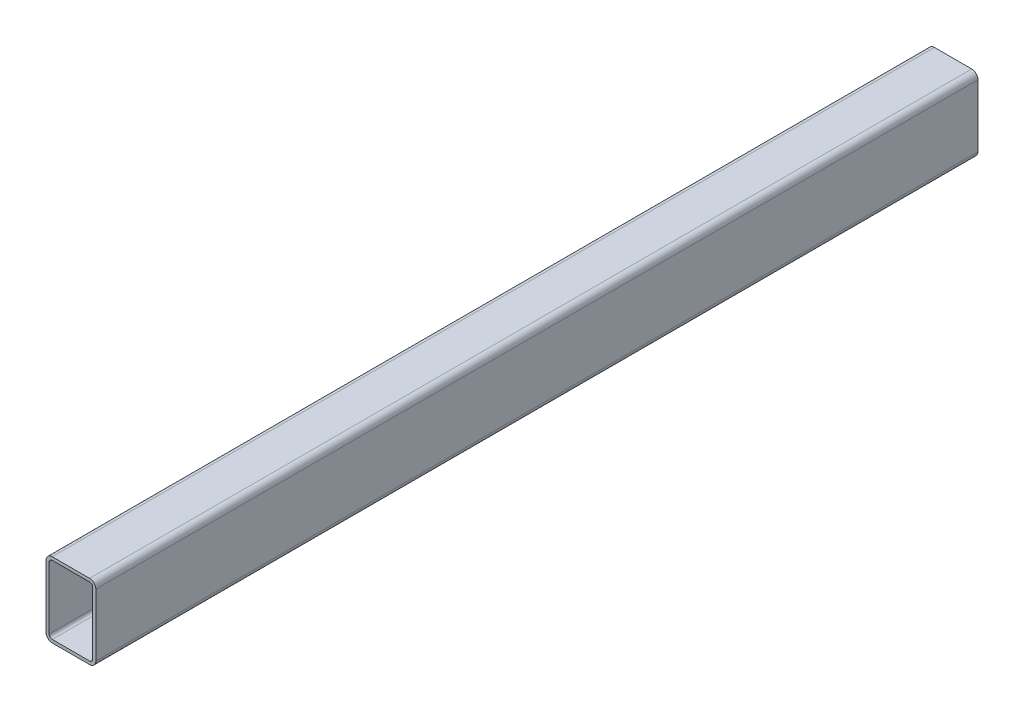
from build123d import *

# Parameters (mm, degrees)
BOSS_EXTRUDE2_DEPTH = 449.961


with BuildPart() as part:
    # Sketch13 → Boss-Extrude2 (new, symmetric)
    with BuildSketch(Plane.XY):
        with BuildLine():
            Line((19.05, -38.1), (-19.05, -38.1))
            ThreePointArc((-19.05, -38.1), (-23.540128061, -36.240128061), (-25.4, -31.75))
            Line((-25.4, -31.75), (-25.4, 31.75))
            ThreePointArc((-25.4, 31.75), (-23.540128061, 36.240128061), (-19.05, 38.1))
            Line((-19.05, 38.1), (19.05, 38.1))
            ThreePointArc((19.05, 38.1), (23.540128061, 36.240128061), (25.4, 31.75))
            Line((25.4, 31.75), (25.4, -31.75))
            ThreePointArc((25.4, -31.75), (23.540128061, -36.240128061), (19.05, -38.1))
        make_face()
        with BuildLine():
            Line((19.05, -34.925), (-19.05, -34.925))
            ThreePointArc((-19.05, -34.925), (-21.29506403, -33.99506403), (-22.225, -31.75))
            Line((-22.225, -31.75), (-22.225, 31.75))
            ThreePointArc((-22.225, 31.75), (-21.29506403, 33.99506403), (-19.05, 34.925))
            Line((-19.05, 34.925), (19.05, 34.925))
            ThreePointArc((19.05, 34.925), (21.29506403, 33.99506403), (22.225, 31.75))
            Line((22.225, 31.75), (22.225, -31.75))
            ThreePointArc((22.225, -31.75), (21.29506403, -33.99506403), (19.05, -34.925))
        make_face(mode=Mode.SUBTRACT)
    extrude(amount=BOSS_EXTRUDE2_DEPTH, both=True)


solid = part.part
